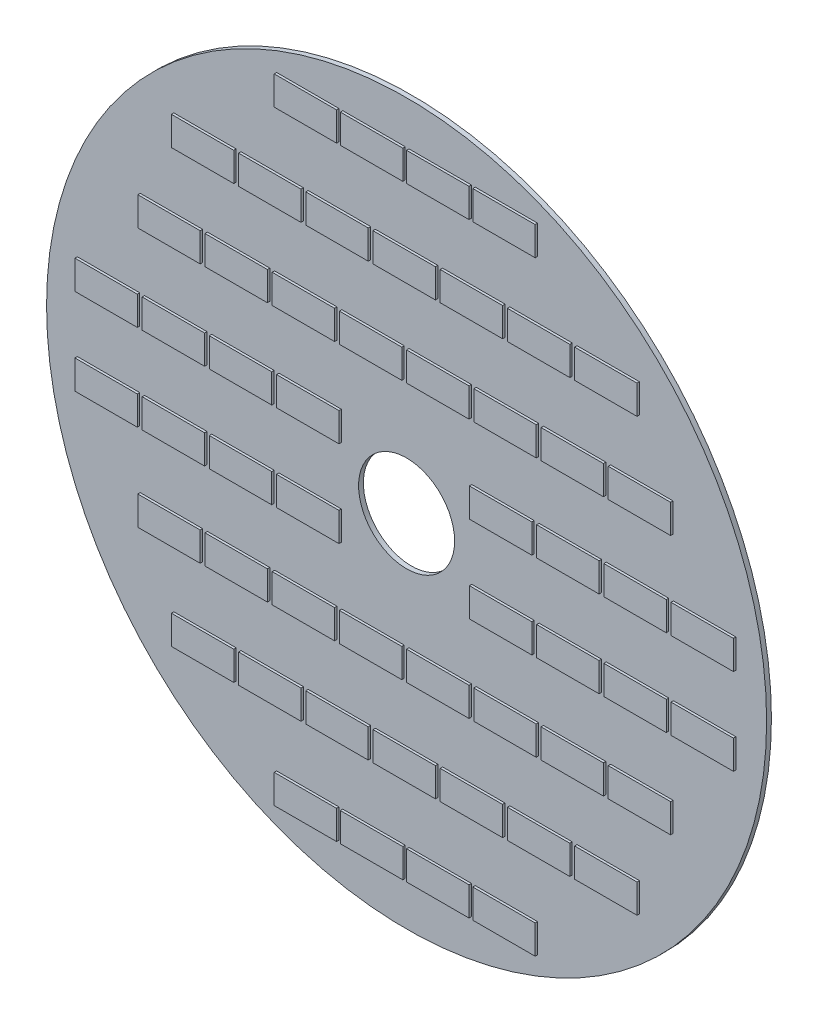
from build123d import *

# Parameters (mm, degrees)
SKETCH_2_R      = 750
SKETCH_2_R_2    = 100
EXTRUDE_1_DEPTH = 10
SKETCH_3_W      = 130
SKETCH_3_H      = 60
EXTRUDE_2_DEPTH = 15


with BuildPart() as part:
    # 草图2 → 凸台-拉伸1 (new body)
    with BuildSketch(Plane.XY):
        Circle(SKETCH_2_R)
        Circle(SKETCH_2_R_2, mode=Mode.SUBTRACT)
    extrude(amount=EXTRUDE_1_DEPTH)

    # 草图3 → 凸台-拉伸2 (add)
    with BuildSketch(Plane.XY):
        with Locations((200.905717719, 90)):
            Rectangle(SKETCH_3_W, SKETCH_3_H)
        with Locations((340.905717719, 90)):
            Rectangle(SKETCH_3_W, SKETCH_3_H)
        with Locations((480.905717719, 90)):
            Rectangle(SKETCH_3_W, SKETCH_3_H)
        with Locations((620.905717719, 90)):
            Rectangle(SKETCH_3_W, SKETCH_3_H)
        with Locations((210, 270)):
            Rectangle(SKETCH_3_W, SKETCH_3_H)
        with Locations((-620.905717719, 90)):
            Rectangle(SKETCH_3_W, SKETCH_3_H)
        with Locations((-480.905717719, 90)):
            Rectangle(SKETCH_3_W, SKETCH_3_H)
        with Locations((-340.905717719, 90)):
            Rectangle(SKETCH_3_W, SKETCH_3_H)
        with Locations((-200.905717719, 90)):
            Rectangle(SKETCH_3_W, SKETCH_3_H)
        with Locations((70, 270)):
            Rectangle(SKETCH_3_W, SKETCH_3_H)
        with Locations((350, 270)):
            Rectangle(SKETCH_3_W, SKETCH_3_H)
        with Locations((490, 270)):
            Rectangle(SKETCH_3_W, SKETCH_3_H)
        with Locations((-490, 270)):
            Rectangle(SKETCH_3_W, SKETCH_3_H)
        with Locations((-350, 270)):
            Rectangle(SKETCH_3_W, SKETCH_3_H)
        with Locations((-210, 270)):
            Rectangle(SKETCH_3_W, SKETCH_3_H)
        with Locations((-70, 270)):
            Rectangle(SKETCH_3_W, SKETCH_3_H)
        with Locations((140, 450)):
            Rectangle(SKETCH_3_W, SKETCH_3_H)
        with Locations((0, 450)):
            Rectangle(SKETCH_3_W, SKETCH_3_H)
        with Locations((280, 450)):
            Rectangle(SKETCH_3_W, SKETCH_3_H)
        with Locations((420, 450)):
            Rectangle(SKETCH_3_W, SKETCH_3_H)
        with Locations((-420, 450)):
            Rectangle(SKETCH_3_W, SKETCH_3_H)
        with Locations((-280, 450)):
            Rectangle(SKETCH_3_W, SKETCH_3_H)
        with Locations((-140, 450)):
            Rectangle(SKETCH_3_W, SKETCH_3_H)
        with Locations((-67.907281847, 630)):
            Rectangle(SKETCH_3_W, SKETCH_3_H)
        with Locations((-205.814563694, 630)):
            Rectangle(SKETCH_3_W, SKETCH_3_H)
        with Locations((70, 630)):
            Rectangle(SKETCH_3_W, SKETCH_3_H)
        with Locations((207.907281847, 630)):
            Rectangle(SKETCH_3_W, SKETCH_3_H)
        with Locations((207.907281847, -630)):
            Rectangle(SKETCH_3_W, SKETCH_3_H)
        with Locations((70, -630)):
            Rectangle(SKETCH_3_W, SKETCH_3_H)
        with Locations((-67.907281847, -630)):
            Rectangle(SKETCH_3_W, SKETCH_3_H)
        with Locations((-205.814563694, -630)):
            Rectangle(SKETCH_3_W, SKETCH_3_H)
        with Locations((-140, -450)):
            Rectangle(SKETCH_3_W, SKETCH_3_H)
        with Locations((-280, -450)):
            Rectangle(SKETCH_3_W, SKETCH_3_H)
        with Locations((-420, -450)):
            Rectangle(SKETCH_3_W, SKETCH_3_H)
        with Locations((420, -450)):
            Rectangle(SKETCH_3_W, SKETCH_3_H)
        with Locations((280, -450)):
            Rectangle(SKETCH_3_W, SKETCH_3_H)
        with Locations((140, -450)):
            Rectangle(SKETCH_3_W, SKETCH_3_H)
        with Locations((0, -450)):
            Rectangle(SKETCH_3_W, SKETCH_3_H)
        with Locations((-210, -270)):
            Rectangle(SKETCH_3_W, SKETCH_3_H)
        with Locations((-70, -270)):
            Rectangle(SKETCH_3_W, SKETCH_3_H)
        with Locations((-350, -270)):
            Rectangle(SKETCH_3_W, SKETCH_3_H)
        with Locations((-490, -270)):
            Rectangle(SKETCH_3_W, SKETCH_3_H)
        with Locations((490, -270)):
            Rectangle(SKETCH_3_W, SKETCH_3_H)
        with Locations((350, -270)):
            Rectangle(SKETCH_3_W, SKETCH_3_H)
        with Locations((210, -270)):
            Rectangle(SKETCH_3_W, SKETCH_3_H)
        with Locations((70, -270)):
            Rectangle(SKETCH_3_W, SKETCH_3_H)
        with Locations((-200.905717719, -90)):
            Rectangle(SKETCH_3_W, SKETCH_3_H)
        with Locations((-340.905717719, -90)):
            Rectangle(SKETCH_3_W, SKETCH_3_H)
        with Locations((-480.905717719, -90)):
            Rectangle(SKETCH_3_W, SKETCH_3_H)
        with Locations((-620.905717719, -90)):
            Rectangle(SKETCH_3_W, SKETCH_3_H)
        with Locations((620.905717719, -90)):
            Rectangle(SKETCH_3_W, SKETCH_3_H)
        with Locations((480.905717719, -90)):
            Rectangle(SKETCH_3_W, SKETCH_3_H)
        with Locations((340.905717719, -90)):
            Rectangle(SKETCH_3_W, SKETCH_3_H)
        with Locations((200.905717719, -90)):
            Rectangle(SKETCH_3_W, SKETCH_3_H)
    extrude(amount=EXTRUDE_2_DEPTH)


solid = part.part
